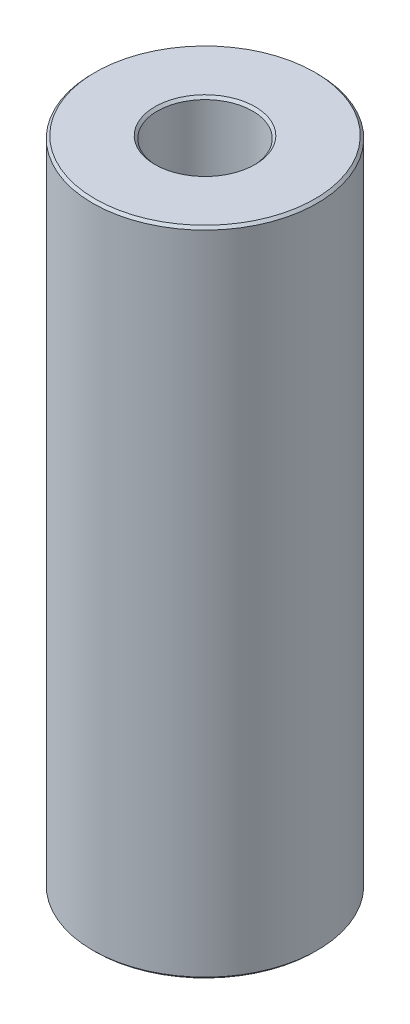
from build123d import *

# Parameters (mm, degrees)
SKETCH1_R           = 17.5
BOSS_EXTRUDE1_DEPTH = 101.614682838
SKETCH2_R           = 7.422173412
CUT_EXTRUDE1_DEPTH  = 105.585102994
CHAMFER1_SIZE       = 0.387153321


with BuildPart() as part:
    # Sketch1 → Boss-Extrude1 (new body)
    with BuildSketch(Plane(origin=(0, 0, 0), x_dir=(1, 0, 0), z_dir=(0, 1, 0))):
        Circle(SKETCH1_R)
    extrude(amount=BOSS_EXTRUDE1_DEPTH)

    # Sketch2 → Cut-Extrude1 (cut, through all)
    with BuildSketch(Plane(origin=(0, 0, 0), x_dir=(1, 0, 0), z_dir=(0, 1, 0))):
        Circle(SKETCH2_R)
    extrude(amount=CUT_EXTRUDE1_DEPTH, mode=Mode.SUBTRACT)

    # Chamfer1
    chamfer1_edges = [part.edges().sort_by_distance(p)[0] for p in [
        (-7.422173412, 101.614682838, 0),
        (-7.422173412, 0, 0),
        (-17.5, 0, 0),
        (-17.5, 101.614682838, 0),
    ]]
    chamfer(chamfer1_edges, length=CHAMFER1_SIZE)


solid = part.part
